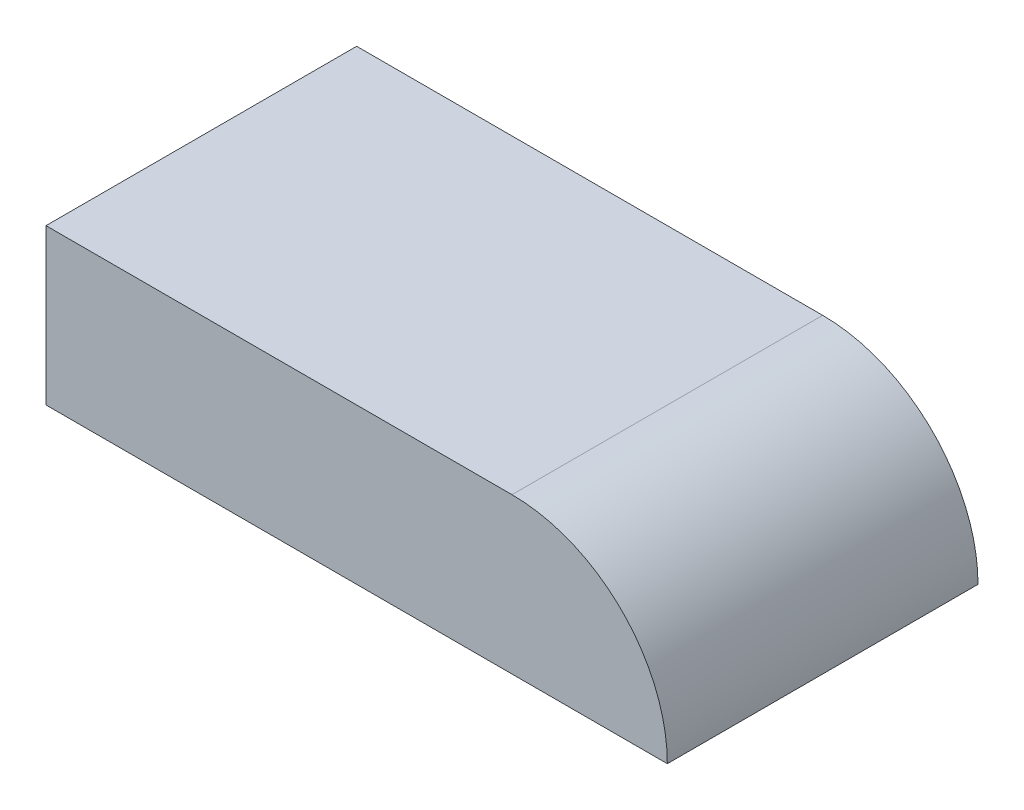
from build123d import *

# Parameters (mm, degrees)
ESQUISSE1_W        = 20
ESQUISSE1_H        = 5
BOSS_EXTRU_1_DEPTH = 10
CONG_1_R           = 5


with BuildPart() as part:
    # Esquisse1 → Boss.-Extru.1 (new body)
    with BuildSketch(Plane.XY):
        with Locations((10, 2.5)):
            Rectangle(ESQUISSE1_W, ESQUISSE1_H)
    extrude(amount=BOSS_EXTRU_1_DEPTH)

    # Congé1
    cong_1_edges = [part.edges().sort_by_distance(p)[0] for p in [
        (20, 5, 5),
    ]]
    fillet(cong_1_edges, radius=CONG_1_R - 0.0001)  # a hair under: the kernel refuses the full size


solid = part.part
